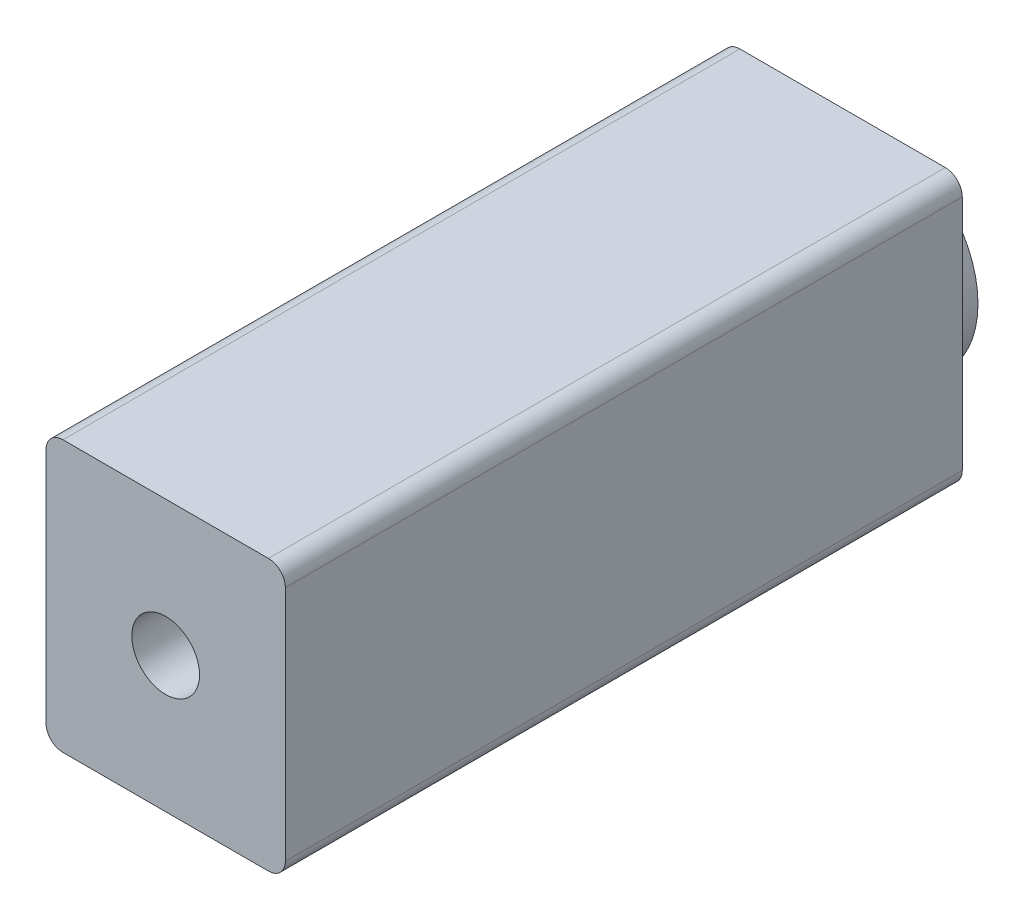
from build123d import *

# Parameters (mm, degrees)
SKETCH1_R           = 30
BOSS_EXTRUDE1_DEPTH = 10
SKETCH2_W           = 70.710678118
SKETCH2_H           = 80
BOSS_EXTRUDE2_DEPTH = 200
SKETCH3_R           = 10
CUT_EXTRUDE1_DEPTH  = 150
SHELL1_START        = 12
SHELL1_OUTLINE_W    = 66.710678118
SHELL1_OUTLINE_H    = 76
SHELL1_OUTLINE_R    = 12
SHELL1_DEPTH        = 196
SHELL1_START_2      = 2
SHELL1_2_OUTLINE_R  = 28
SHELL1_2_DEPTH      = 56
FILLET1_R           = 5


# Read off the part's stored shape, not the designer's step: Shell1
with BuildPart() as part:
    # Sketch1 → Boss-Extrude1 (new body)
    with BuildSketch(Plane.XY):
        Circle(SKETCH1_R)
    extrude(amount=BOSS_EXTRUDE1_DEPTH)

    # Sketch2 → Boss-Extrude2 (add)
    with BuildSketch(Plane.XY.offset(10)):
        Rectangle(SKETCH2_W, SKETCH2_H)
    extrude(amount=BOSS_EXTRUDE2_DEPTH)

    # Sketch3 → Cut-Extrude1 (cut)
    with BuildSketch(Plane.XY.offset(210)):
        Circle(SKETCH3_R)
    extrude(amount=-CUT_EXTRUDE1_DEPTH, mode=Mode.SUBTRACT)

    # Shell1 outline → Shell1 (cut)
    with BuildSketch(Plane.XY.offset(SHELL1_START)):
        Rectangle(SHELL1_OUTLINE_W, SHELL1_OUTLINE_H)
        Circle(SHELL1_OUTLINE_R, mode=Mode.SUBTRACT)
    extrude(amount=SHELL1_DEPTH, mode=Mode.SUBTRACT)

    # Shell1 2 outline → Shell1 2 (cut)
    with BuildSketch(Plane.XY.offset(SHELL1_START_2)):
        Circle(SHELL1_2_OUTLINE_R)
    extrude(amount=SHELL1_2_DEPTH, mode=Mode.SUBTRACT)

    # Fillet1
    fillet1_edges = [part.edges().sort_by_distance(p)[0] for p in [
        (-35.355339059, 40, 110),
        (-35.355339059, -40, 110),
        (35.355339059, -40, 110),
        (35.355339059, 40, 110),
    ]]
    fillet(fillet1_edges, radius=FILLET1_R)


solid = part.part
